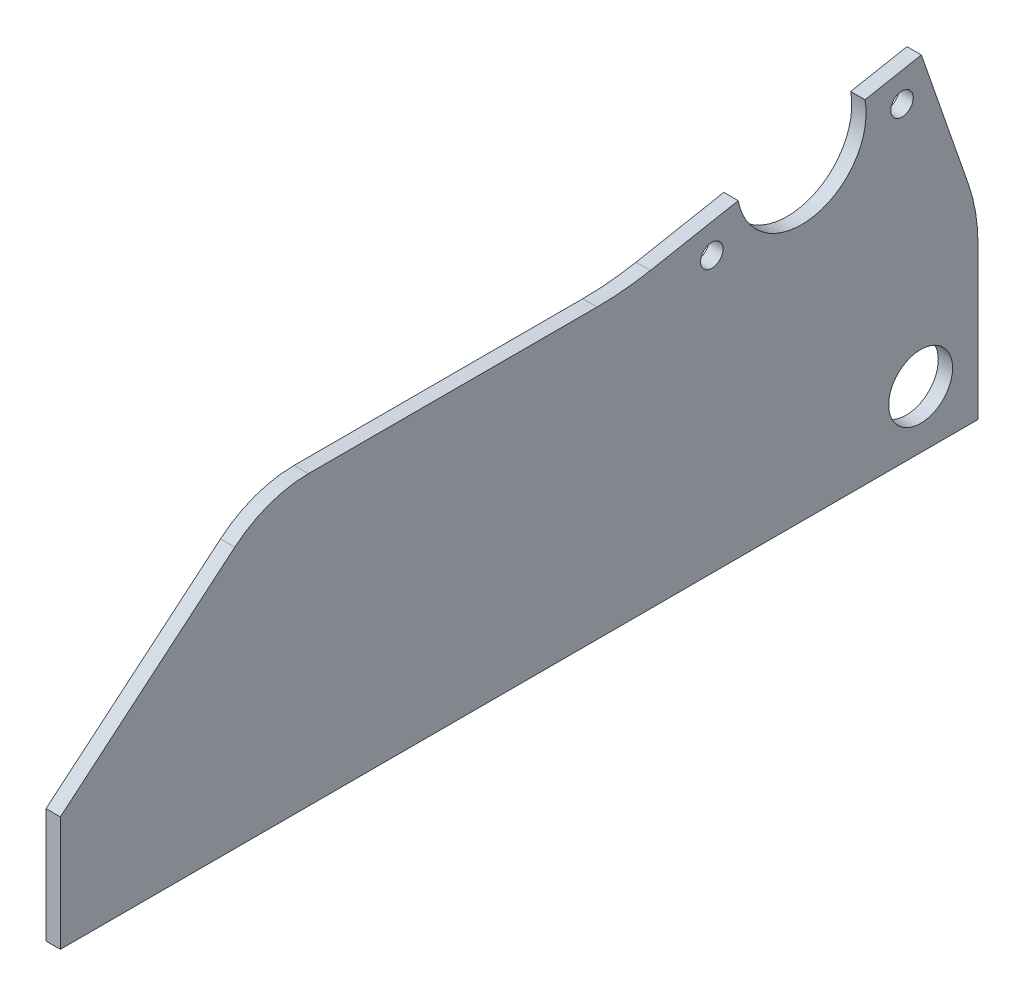
from build123d import *

# Parameters (mm, degrees)
BOSS_EXTRUDE1_DEPTH    = 3.175
F_10_CLEARANCE_HOLE1_D = 4.9784
SKETCH9_R              = 7.0739
CUT_EXTRUDE1_DEPTH     = 207.765399971
FILLET1_R              = 38.1
FILLET2_R              = 63.5


with BuildPart() as part:
    # Sketch1 → Boss-Extrude1 (new body)
    with BuildSketch(Plane(origin=(0, 0, 0), x_dir=(0, 0, -1), z_dir=(1, 0, 0))):
        with BuildLine():
            Line((0, -38.1), (0, 1.990947987))
            Line((0, 1.990947987), (-12.542971184, 38.1))
            Line((-12.542971184, 38.1), (-25.022125172, 35.741883009))
            ThreePointArc((-25.022125172, 35.741883009), (-36.408291793, 19.049953157), (-53.100221645, 30.436119779))
            Line((-53.100221645, 30.436119779), (-78.393569898, 25.656575081))
            Line((-78.393569898, 25.656575081), (-148.243569898, 25.656575081))
            ThreePointArc((-148.243569898, 25.656575081), (-156.930881538, 24.124767649), (-164.570375184, 19.714103936))
            Line((-164.570375184, 19.714103936), (-203.2, -12.7))
            Line((-203.2, -12.7), (-203.2, -38.1))
            Line((-203.2, -38.1), (0, -38.1))
        make_face()
    extrude(amount=BOSS_EXTRUDE1_DEPTH)

    # #10 Clearance Hole1 (through all)
    with Locations(Plane(origin=(3.175, 0, 0), x_dir=(0, 0, -1), z_dir=(1, 0, 0))):
        with Locations((-58.940687267, 22.870101977), (-16.823542558, 30.828746822)):
            Hole(F_10_CLEARANCE_HOLE1_D / 2)

    # Sketch9 → Cut-Extrude1 (cut, through all)
    with BuildSketch(Plane(origin=(3.175, 0, 0), x_dir=(0, 0, -1), z_dir=(1, 0, 0))):
        with Locations((-12.7, -25.4)):
            Circle(SKETCH9_R)
    extrude(amount=-CUT_EXTRUDE1_DEPTH, mode=Mode.SUBTRACT)

    # Fillet1
    fillet1_edges = [part.edges().sort_by_distance(p)[0] for p in [
        (1.5875, 1.990947987, 0),
    ]]
    fillet(fillet1_edges, radius=FILLET1_R)

    # Fillet2
    fillet2_edges = [part.edges().sort_by_distance(p)[0] for p in [
        (1.5875, 25.656575081, 78.393569898),
    ]]
    fillet(fillet2_edges, radius=FILLET2_R)


solid = part.part
